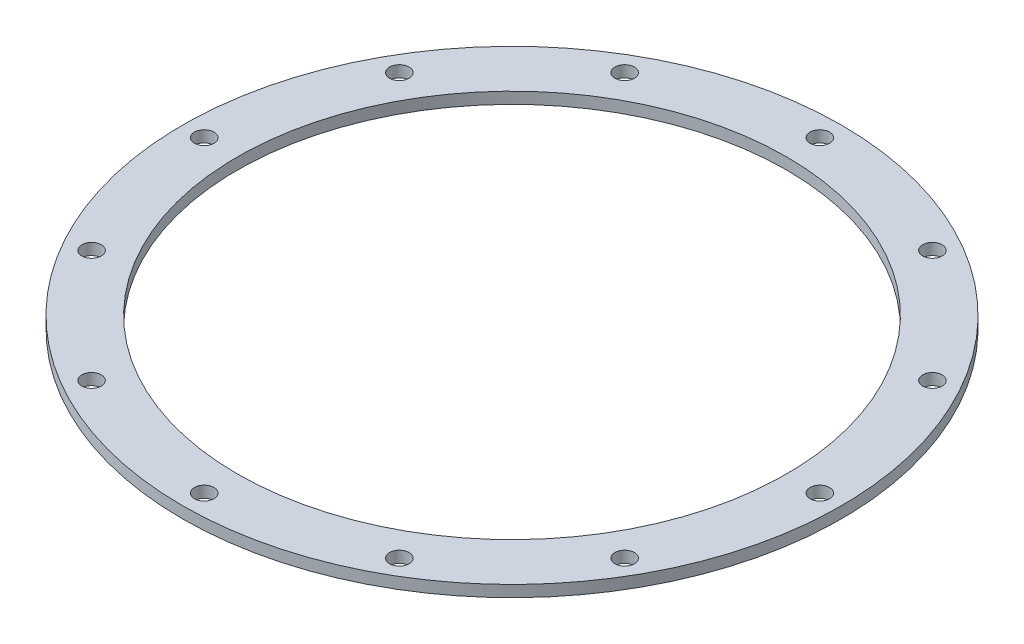
from build123d import *

# Parameters (mm, degrees)
SKETCH1_W                    = 7.62
SKETCH1_H                    = 1.5875
F_36_0_1065_DIAMETER_HOLE1_D = 2.7051
SCREW_PASSTHROUGHS_COUNT     = 12


with BuildPart() as part:
    # Sketch1 → Main (revolve)
    with BuildSketch(Plane.XY):
        with Locations((-41.91, 0.79375)):
            Rectangle(SKETCH1_W, SKETCH1_H)
    revolve(axis=Axis((0, 55, 0), (0, -1, 0)))

    # #36 (0.1065) Diameter Hole1 (through all)
    with Locations(Plane(origin=(0, 0, 0), x_dir=(-1, 0, 0), z_dir=(0, -1, 0))):
        with Locations((42.700575, 0)):
            f_36_0_1065_diameter_hole1 = Hole(F_36_0_1065_DIAMETER_HOLE1_D / 2)

    # Screw Passthroughs: #36 (0.1065) Diameter Hole1 ×12 about axis
    screw_passthroughs_axis = Axis((0, 55, 0), (0, -1, 0))
    for i in range(1, SCREW_PASSTHROUGHS_COUNT):
        add(f_36_0_1065_diameter_hole1.rotate(screw_passthroughs_axis, i * 360 / SCREW_PASSTHROUGHS_COUNT), mode=Mode.SUBTRACT)


solid = part.part
